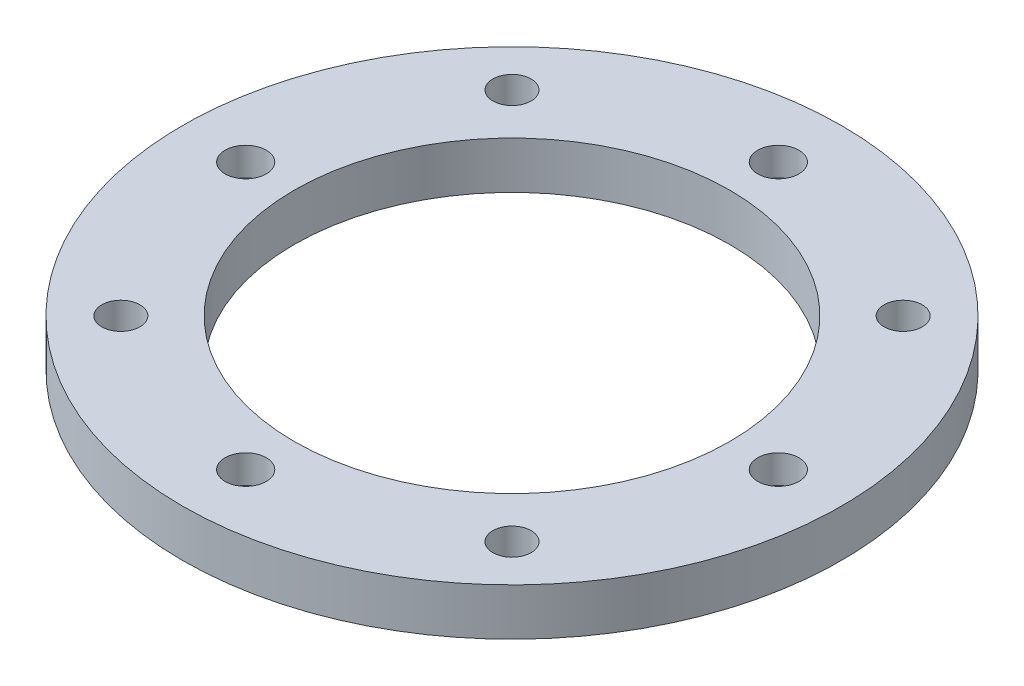
from build123d import *

# Parameters (mm, degrees)
SKETCH1_W                                        = 177.8
SKETCH1_H                                        = 177.8
BOSS_EXTRUDE1_DEPTH                              = 12.7
F_13_32_0_40625_DIAMETER_HOLE1_D                 = 10.31875
SKETCH4_R                                        = 58.7375
CUT_EXTRUDE1_DEPTH                               = 127.363404513
SKETCH5_OUTSIDE_W                                = 230.154
SKETCH5_OUTSIDE_H                                = 230.154
SKETCH5_OUTSIDE_R                                = 88.9
CUT_EXTRUDE2_DEPTH                               = 12.7
CBORE_FOR_1_4_SOCKET_HEAD_CAP_SCREW1_D           = 6.7564
CBORE_FOR_1_4_SOCKET_HEAD_CAP_SCREW1_CBORE_D     = 11.1125
CBORE_FOR_1_4_SOCKET_HEAD_CAP_SCREW1_CBORE_DEPTH = 7.62


with BuildPart() as part:
    # Sketch1 → Boss-Extrude1 (new body)
    with BuildSketch(Plane(origin=(0, 0, 0), x_dir=(1, 0, 0), z_dir=(0, 1, 0))):
        Rectangle(SKETCH1_W, SKETCH1_H)
    extrude(amount=BOSS_EXTRUDE1_DEPTH)

    # 13/32 (0.40625) Diameter Hole1 (through all)
    with Locations(Plane(origin=(-52.759004711, 12.7, -52.759004711), x_dir=(0, 0, 1), z_dir=(0, 1, 0))):
        with Locations((0, 0), (0, 105.518009422), (105.518009422, 105.518009422), (105.518009422, 0)):
            Hole(F_13_32_0_40625_DIAMETER_HOLE1_D / 2)

    # Sketch4 → Cut-Extrude1 (cut, through all)
    with BuildSketch(Plane(origin=(0, 12.7, 0), x_dir=(1, 0, 0), z_dir=(0, 1, 0))):
        Circle(SKETCH4_R)
    extrude(amount=-CUT_EXTRUDE1_DEPTH, mode=Mode.SUBTRACT)

    # Sketch5 outside → Cut-Extrude2 (cut)
    with BuildSketch(Plane(origin=(0, 12.7, 0), x_dir=(1, 0, 0), z_dir=(0, 1, 0))):
        Rectangle(SKETCH5_OUTSIDE_W, SKETCH5_OUTSIDE_H)
        Circle(SKETCH5_OUTSIDE_R, mode=Mode.SUBTRACT)
    extrude(amount=-CUT_EXTRUDE2_DEPTH, mode=Mode.SUBTRACT)

    # CBORE for 1/4 Socket Head Cap Screw1 (through all)
    with Locations(Plane(origin=(0, 12.7, -71.842048969), x_dir=(0, 0, 1), z_dir=(0, 1, 0))):
        with Locations((0, 0), (71.842048969, 71.842048969), (71.842048969, -71.842048969), (143.684097938, 0)):
            CounterBoreHole(CBORE_FOR_1_4_SOCKET_HEAD_CAP_SCREW1_D / 2, CBORE_FOR_1_4_SOCKET_HEAD_CAP_SCREW1_CBORE_D / 2, CBORE_FOR_1_4_SOCKET_HEAD_CAP_SCREW1_CBORE_DEPTH)


solid = part.part
